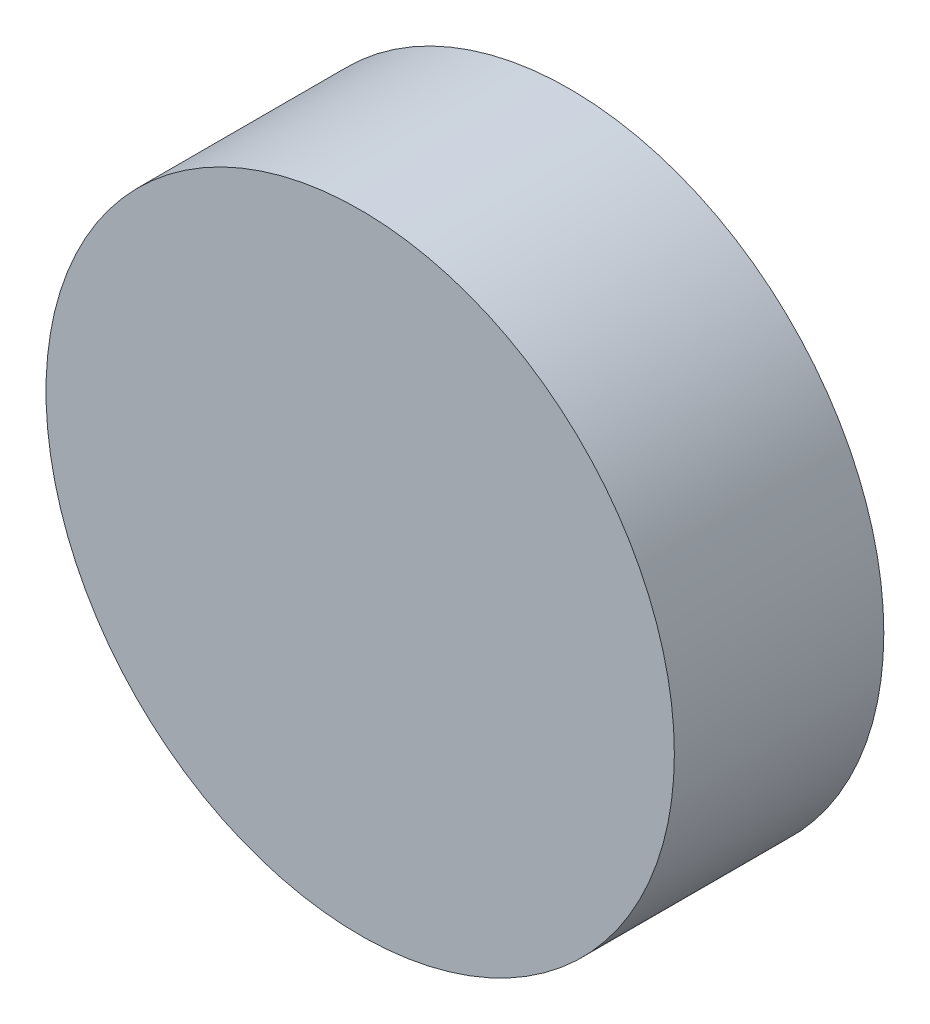
from build123d import *

# Parameters (mm, degrees)
SKETCH1_R           = 75
BOSS_EXTRUDE1_DEPTH = 50


with BuildPart() as part:
    # Sketch1 → Boss-Extrude1 (new body)
    with BuildSketch(Plane.XY):
        Circle(SKETCH1_R)
    extrude(amount=BOSS_EXTRUDE1_DEPTH)


solid = part.part
